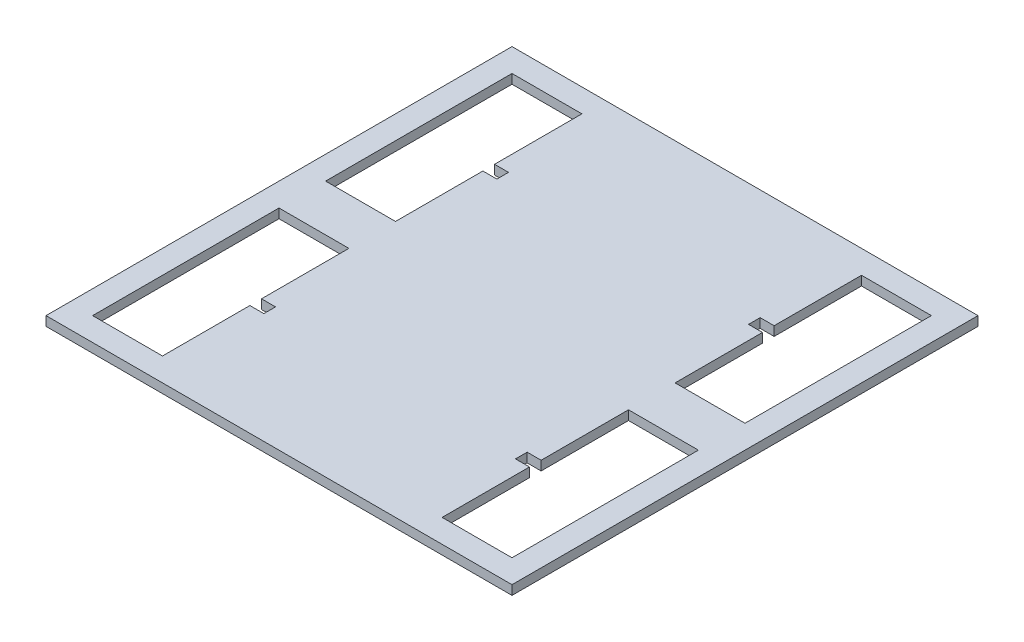
from build123d import *

# Parameters (mm, degrees)
SKETCH1_W          = 400
SKETCH1_H          = 400
BASE_FLANGE1_DEPTH = 8
CUT_EXTRUDE1_DEPTH = 10


# Sheet-metal steps are written as plain solids
with BuildPart() as part:
    # Sketch1 → Base-Flange1 (new body)
    with BuildSketch(Plane(origin=(0, 0, 0), x_dir=(1, 0, 0), z_dir=(0, 1, 0))):
        with Locations((200, 200)):
            Rectangle(SKETCH1_W, SKETCH1_H)
    extrude(amount=-BASE_FLANGE1_DEPTH)

    # Sketch2 → Cut-Extrude1 (cut)
    with BuildSketch(Plane(origin=(0, 0, 0), x_dir=(1, 0, 0), z_dir=(0, 1, 0))):
        Polygon((80, 295), (80, 220), (20, 220), (20, 380), (80, 380), (80, 305), (92, 305), (92, 295), align=None)
        Polygon((92, 105), (80, 105), (80, 180), (20, 180), (20, 20), (80, 20), (80, 95), (92, 95), align=None)
        Polygon((320, 105), (320, 180), (380, 180), (380, 20), (320, 20), (320, 95), (308, 95), (308, 105), align=None)
        Polygon((308, 295), (320, 295), (320, 220), (380, 220), (380, 380), (320, 380), (320, 305), (308, 305), align=None)
    extrude(amount=-CUT_EXTRUDE1_DEPTH, mode=Mode.SUBTRACT)


solid = part.part
